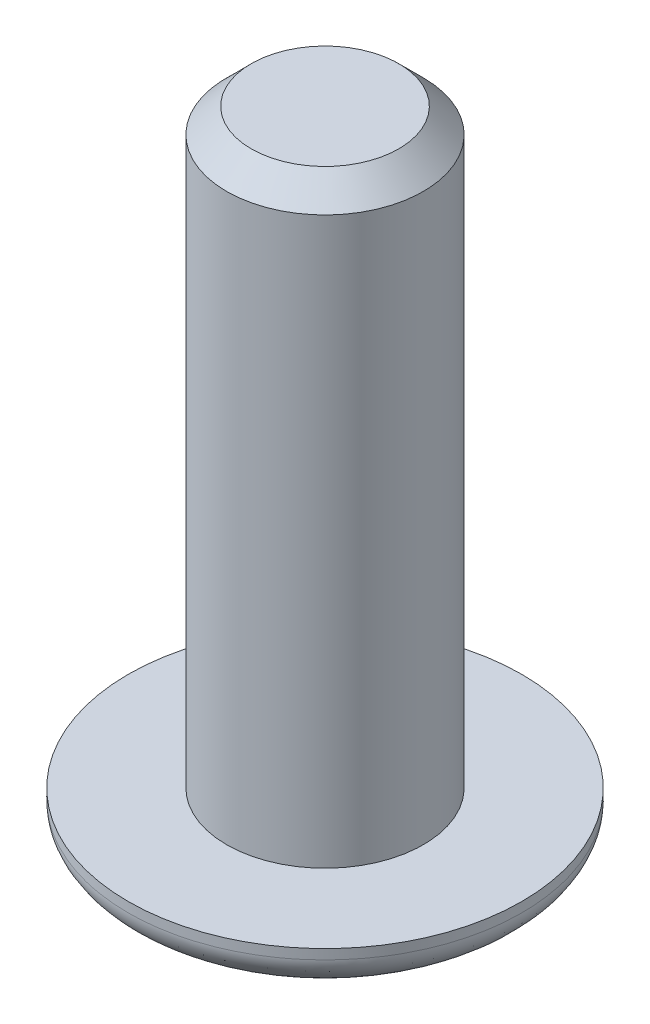
from build123d import *

# Parameters (mm, degrees)
SKETCH_1_R      = 4
EXTRUDE_1_DEPTH = 1.2
SKETCH_2_R      = 2
EXTRUDE_2_DEPTH = 12
CHAMFER_1_SIZE  = 0.5
FILLET_1_SIZE   = 1
FILLET_1_SIZE_2 = 2


with BuildPart() as part:
    # 草图1 → 凸台-拉伸1 (new body)
    with BuildSketch(Plane(origin=(0, 0, 0), x_dir=(1, 0, 0), z_dir=(0, 1, 0))):
        with Locations(Location((0, 0, 0), (0, 0, 270))):
            Circle(SKETCH_1_R)
        Polygon((1.443375673, 0), (0.721687836, 1.25), (-0.721687836, 1.25), (-1.443375673, 0), (-0.721687836, -1.25), (0.721687836, -1.25), align=None, mode=Mode.SUBTRACT)
    extrude(amount=EXTRUDE_1_DEPTH)

    # 草图2 → 凸台-拉伸2 (add)
    with BuildSketch(Plane(origin=(0, 1.2, 0), x_dir=(1, 0, 0), z_dir=(0, 1, 0))):
        with Locations(Location((0, 0, 0), (0, 0, 270))):
            Circle(SKETCH_2_R)
    extrude(amount=EXTRUDE_2_DEPTH)

    # 倒角1
    chamfer_1_edges = [part.edges().sort_by_distance(p)[0] for p in [
        (0, 13.2, -2),
    ]]
    chamfer(chamfer_1_edges, length=CHAMFER_1_SIZE)

    # 圆角1
    # an asymmetric fillet: 2, 1 mm, written as the material it takes off along each edge
    with BuildSketch(Plane(origin=(0, 0, 0), x_dir=(0, 0, 1), z_dir=(-1, 0, 0))) as fillet_1_piece_1:
        with BuildLine():
            Bezier((4, FILLET_1_SIZE), (4, 0), (4 - FILLET_1_SIZE_2, 0), weights=[1, 0.707106781, 1])
            Line((4 - FILLET_1_SIZE_2, 0), (4, 0))
            Line((4, 0), (4, FILLET_1_SIZE))
        make_face()
    revolve(axis=Axis((0, 0, 0), (0, 1, 0)), mode=Mode.SUBTRACT)


solid = part.part
